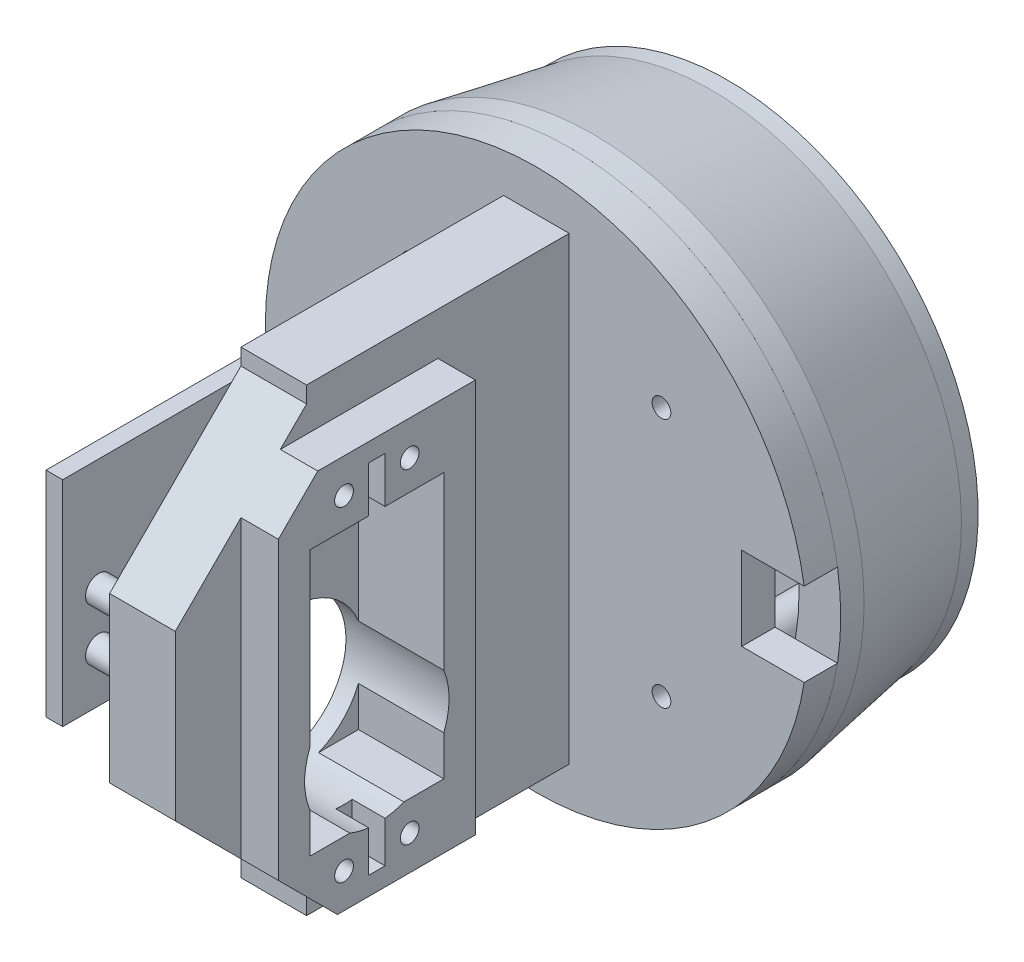
from build123d import *

# Parameters (mm, degrees)
SKETCH2_R                      = 41.27500000000001
SKETCH2_R_2                    = 34.925000000000004
BOSS_EXTRUDE1_DEPTH            = 3.555999999999654
SKETCH54_R                     = 41.27500000000001
SKETCH54_R_2                   = 34.92500000000001
BOSS_EXTRUDE2_DEPTH            = 25.4
BOSS_EXTRUDE2_TAPER            = 10.000000000000021
BOSS_EXTRUDE3_START            = -18.006319777
BOSS_EXTRUDE3_OUTLINE_R        = 38.1
BOSS_EXTRUDE3_DEPTH            = 3.81
BOSS_EXTRUDE5_REACH            = 72.778
SKETCH63_R                     = 3.175000000000002
SKETCH63_R_2                   = 3.175000000000009
SKETCH63_R_3                   = 3.1750000000000056
F_3_0MM_DOWEL_HOLE4_D          = 2.85
F_3_0MM_DOWEL_HOLE4_DEPTH      = 6.858
F_3_0MM_DOWEL_HOLE3_D          = 2.999994
CUT_EXTRUDE2_REACH             = 126.878
SKETCH58_W                     = 12.700000000000001
SKETCH58_H                     = 21.266668123278706
SKETCH60_R                     = 1.4249999999999978
SKETCH60_R_2                   = 1.4250000000000005
CUT_EXTRUDE4_DEPTH             = 70.71188168256496
SKETCH64_R                     = 1.425000000000001
SKETCH64_R_2                   = 1.4249999999999978
SKETCH64_R_3                   = 1.499996999999999
BOSS_EXTRUDE6_DEPTH            = 2.54
SKETCH67_R                     = 41.27500000000003
SKETCH67_R_2                   = 1.4249999999999985
SKETCH67_R_3                   = 1.4249999999999976
BOSS_EXTRUDE7_DEPTH            = 5.08
SKETCH68_W                     = 20
SKETCH68_H                     = 12.7
CUT_EXTRUDE5_DEPTH             = 5.08
BOSS_EXTRUDE8_START            = 11.43
SKETCH70_W                     = 70.00000000000001
SKETCH70_H                     = 70
BOSS_EXTRUDE8_DEPTH            = 5
BOSS_EXTRUDE9_DEPTH            = 5.699999999999999
CUT_EXTRUDE6_DEPTH             = 13
F_3_0MM_DOWEL_HOLE5_AT_2_COUNT = 2
F_3_0MM_DOWEL_HOLE5_AT_2_PITCH = 10
F_3_0MM_DOWEL_HOLE5_AT_3_COUNT = 2
F_3_0MM_DOWEL_HOLE5_AT_3_PITCH = 49.5
F_3_0MM_DOWEL_HOLE5_AT_4_COUNT = 2
F_3_0MM_DOWEL_HOLE5_AT_4_PITCH = 50.5
CUT_EXTRUDE7_DEPTH             = 100.24306365899265
CUT_EXTRUDE7_DEPTH_BACK        = 100.24306365899265
SKETCH76_R                     = 11
CUT_EXTRUDE9_DEPTH             = 5
SKETCH78_R                     = 2.5000000000000018
BOSS_EXTRUDE10_DEPTH           = 10
SKETCH79_R                     = 2.000000000000003
BOSS_EXTRUDE11_DEPTH           = 10
CUT_EXTRUDE10_DEPTH            = 101.45785526758407
CHAMFER1_SIZE                  = 1.27
SKETCH81_R                     = 2.510000000000005
SKETCH81_R_2                   = 2.0100035999999983
SKETCH81_R_3                   = 2.0100000000000047
BOSS_EXTRUDE12_DEPTH           = 2.54


with BuildPart() as part:
    # Sketch2 → Boss-Extrude1 (new body)
    with BuildSketch(Plane(origin=(0, 0.7215916123591171, 0), x_dir=(1, 0, 0), z_dir=(0, 0, 1))):
        with Locations((11.43, -1.4797279014976155)):
            Circle(SKETCH2_R)
        with Locations((11.43, -1.4797279014976155)):
            Circle(SKETCH2_R_2, mode=Mode.SUBTRACT)
    extrude(amount=BOSS_EXTRUDE1_DEPTH)

    # Sketch54 → Boss-Extrude2 (add)
    with BuildSketch(Plane(origin=(0, 0, 0), x_dir=(-1, 0, 0), z_dir=(0, 0, -1))):
        with Locations((-11.43, -0.7581362891384984)):
            Circle(SKETCH54_R)
        with Locations(Location((-11.43, -0.7581362891384984, 0), (0, 0, 180))):
            Circle(SKETCH54_R_2, mode=Mode.SUBTRACT)
    extrude(amount=BOSS_EXTRUDE2_DEPTH, taper=BOSS_EXTRUDE2_TAPER)

    # Boss-Extrude3: read off the stored shape, not the designer's step
    # Boss-Extrude3 outline → Boss-Extrude3 (add)
    with BuildSketch(Plane.XY.offset(BOSS_EXTRUDE3_START)):
        with Locations((11.43, -0.758136289)):
            Circle(BOSS_EXTRUDE3_OUTLINE_R)
    extrude(amount=BOSS_EXTRUDE3_DEPTH)

    # Sketch63 → Boss-Extrude5 (add, up to next)
    with BuildSketch(Plane.XY.offset(3.555999999999654), mode=Mode.PRIVATE) as boss_extrude5_sk1:
        with Locations((-7.620000000000005, 18.291863710861502)):
            Circle(SKETCH63_R)
    boss_extrude5_tool1 = extrude(boss_extrude5_sk1.sketch, amount=-BOSS_EXTRUDE5_REACH, mode=Mode.PRIVATE) - part.part
    # Sketch63 → Boss-Extrude5 (add, up to next)
    with BuildSketch(Plane.XY.offset(3.555999999999654), mode=Mode.PRIVATE) as boss_extrude5_sk2:
        with Locations((30.479999999999997, 18.29186371086151)):
            Circle(SKETCH63_R_2)
    boss_extrude5_tool2 = extrude(boss_extrude5_sk2.sketch, amount=-BOSS_EXTRUDE5_REACH, mode=Mode.PRIVATE) - part.part
    # Sketch63 → Boss-Extrude5 (add, up to next)
    with BuildSketch(Plane.XY.offset(3.555999999999654), mode=Mode.PRIVATE) as boss_extrude5_sk3:
        with Locations((30.480000000000004, -19.8081362891385)):
            Circle(SKETCH63_R_2)
    boss_extrude5_tool3 = extrude(boss_extrude5_sk3.sketch, amount=-BOSS_EXTRUDE5_REACH, mode=Mode.PRIVATE) - part.part
    # Sketch63 → Boss-Extrude5 (add, up to next)
    with BuildSketch(Plane.XY.offset(3.555999999999654), mode=Mode.PRIVATE) as boss_extrude5_sk4:
        with Locations((-7.620000000000005, -19.8081362891385)):
            Circle(SKETCH63_R_3)
    boss_extrude5_tool4 = extrude(boss_extrude5_sk4.sketch, amount=-BOSS_EXTRUDE5_REACH, mode=Mode.PRIVATE) - part.part
    add(boss_extrude5_tool1.solids().sort_by_distance((-7.62, 18.291864, 3.556))[0])
    add(boss_extrude5_tool2.solids().sort_by_distance((30.48, 18.291864, 3.556))[0])
    add(boss_extrude5_tool3.solids().sort_by_distance((30.48, -19.808136, 3.556))[0])
    add(boss_extrude5_tool4.solids().sort_by_distance((-7.62, -19.808136, 3.556))[0])

    # Ø3.0mm Dowel Hole4
    with Locations(Plane.XY.offset(3.555999999999654)):
        with Locations((-7.62, 18.291863711), (30.48, 18.291863711), (30.48, -19.808136289), (-7.62, -19.808136289)):
            Hole(F_3_0MM_DOWEL_HOLE4_D / 2, depth=F_3_0MM_DOWEL_HOLE4_DEPTH)

    # Ø3.0mm Dowel Hole3 (through all)
    with Locations(Plane(origin=(0, 0, -18.006319777286222), x_dir=(-1, 0, 0), z_dir=(0, 0, -1))):
        with Locations((-11.43, -0.758136289)):
            Hole(F_3_0MM_DOWEL_HOLE3_D / 2)

    # Cut-Extrude2: up to this cone (the profile starts outside it)
    cut_extrude2_end = Plane(origin=(11.43, -0.7581362891384984, -11.65632), z_dir=(0, 0, -1)) * Cone(7.999516737370435, 65.961130686173, 328.7166474235434, mode=Mode.PRIVATE)
    # Sketch58 → Cut-Extrude2 (cut, up to the surface)
    with BuildSketch(Plane(origin=(-63.5, 0, 0), x_dir=(0, 0, -1), z_dir=(1, 0, 0)), mode=Mode.PRIVATE) as cut_extrude2_sk1:
        with Locations((11.656319777286228, -0.08753137128510957)):
            Rectangle(SKETCH58_W, SKETCH58_H)
    cut_extrude2_tool1 = extrude(cut_extrude2_sk1.sketch, amount=CUT_EXTRUDE2_REACH, mode=Mode.PRIVATE) - cut_extrude2_end
    add(cut_extrude2_tool1.solids().sort_by_distance((-63.5, -0.087531, -11.65632))[0], mode=Mode.SUBTRACT)

    # Sketch60 → Cut-Extrude4 (cut, through all)
    with BuildSketch(Plane.XY.offset(-14.196319777286222)):
        with Locations((18.43, -0.7581362891384957)):
            Circle(SKETCH60_R)
        with Locations((4.429999999999999, -0.7581362891384984)):
            Circle(SKETCH60_R_2)
    extrude(amount=-CUT_EXTRUDE4_DEPTH, mode=Mode.SUBTRACT)

    # Sketch64 → Boss-Extrude6 (add)
    with BuildSketch(Plane(origin=(0, 0, -18.006319777286222), x_dir=(-1, 0, 0), z_dir=(0, 0, -1))):
        with BuildLine():
            ThreePointArc((25.344366452837203, -10.720865432924475), (26.663599038852283, -0.05977229582778121), (24.954487952256596, 10.545802690354252))
            ThreePointArc((24.954487952256596, 10.545802690354252), (-49.52359903885228, -1.4565002824492193), (25.344366452837203, -10.720865432924475))
        make_face()
        with Locations(Location((-4.429999999999999, -0.7581362891384984, 0), (0, 0, 180))):
            Circle(SKETCH64_R, mode=Mode.SUBTRACT)
        with Locations(Location((-18.43, -0.7581362891384957, 0), (0, 0, 180))):
            Circle(SKETCH64_R_2, mode=Mode.SUBTRACT)
        with Locations((-11.43, -0.7581362891384984)):
            Circle(SKETCH64_R_3, mode=Mode.SUBTRACT)
    extrude(amount=BOSS_EXTRUDE6_DEPTH)


with BuildPart() as body_2:
    # Sketch67 → Boss-Extrude7 (new body)
    with BuildSketch(Plane.XY.offset(3.555999999999654)):
        with Locations((11.43, -0.7581362891384984)):
            Circle(SKETCH67_R)
        with Locations((-7.620000000000005, -19.8081362891385)):
            Circle(SKETCH67_R_2, mode=Mode.SUBTRACT)
        with Locations((30.480000000000004, -19.8081362891385)):
            Circle(SKETCH67_R_3, mode=Mode.SUBTRACT)
        with Locations((30.479999999999997, 18.29186371086151)):
            Circle(SKETCH67_R_3, mode=Mode.SUBTRACT)
        with Locations((-7.620000000000005, 18.291863710861502)):
            Circle(SKETCH67_R_2, mode=Mode.SUBTRACT)
    extrude(amount=BOSS_EXTRUDE7_DEPTH)

    # Sketch68 → Cut-Extrude5 (cut)
    with BuildSketch(Plane.XY.offset(8.635999999999655)):
        with Locations((52.70500000000003, -0.7581362891385006)):
            Rectangle(SKETCH68_W, SKETCH68_H)
    extrude(amount=-CUT_EXTRUDE5_DEPTH, mode=Mode.SUBTRACT)

    # Sketch70 → Boss-Extrude8 (add, symmetric)
    with BuildSketch(Plane(origin=(0, 0, 0), x_dir=(0, 0, -1), z_dir=(1, 0, 0)).offset(BOSS_EXTRUDE8_START)):
        with Locations((-43.63599999999966, -0.7581362891384948)):
            Rectangle(SKETCH70_W, SKETCH70_H)
    extrude(amount=BOSS_EXTRUDE8_DEPTH, both=True)

    # Sketch71 → Boss-Extrude9 (add)
    with BuildSketch(Plane(origin=(16.43, 0, 0), x_dir=(0, 0, -1), z_dir=(1, 0, 0))):
        Polygon((-58.635999999999655, 27.741863710861526), (-28.635999999999655, 27.741863710861526), (-28.635999999999648, -32.25813628913847), (-58.63599999999963, -32.25813628913847), align=None)
    extrude(amount=BOSS_EXTRUDE9_DEPTH)

    # Sketch72 → Cut-Extrude6 (cut)
    with BuildSketch(Plane(origin=(22.13, 0, 0), x_dir=(0, 0, -1), z_dir=(1, 0, 0))):
        Polygon((-53.83599999999965, 17.94186371086152), (-33.435999999999645, 17.941863710861533), (-33.435999999999645, -22.458136289138466), (-53.83599999999965, -22.45813628913848), align=None)
    extrude(amount=-CUT_EXTRUDE6_DEPTH, mode=Mode.SUBTRACT)

    # Sketch75 → Ø3.0mm Dowel Hole5 (revolve, cut)
    with BuildSketch(Plane(origin=(22.13, -27.00813628913847, 38.63599999999965), x_dir=(0, 0, -1), z_dir=(0, 1, 0))):
        Polygon((0, 0), (-3.85e-15, 15.700000000000003), (1.4249999999999974, 15.700000000000003), (1.4249999999999994, -1e-17), align=None)
    f_3_0mm_dowel_hole5 = revolve(axis=Axis((28.47999999999999, -27.00813628913847, 38.63599999999965), (-1, 0, 0)), mode=Mode.SUBTRACT)

    # Ø3.0mm Dowel Hole5 at 2: Ø3.0mm Dowel Hole5 ×2
    with Locations(*[(0, 0, i * F_3_0MM_DOWEL_HOLE5_AT_2_PITCH) for i in range(1, F_3_0MM_DOWEL_HOLE5_AT_2_COUNT)]):
        add(f_3_0mm_dowel_hole5, mode=Mode.SUBTRACT)

    # Ø3.0mm Dowel Hole5 at 3: Ø3.0mm Dowel Hole5 ×2
    with Locations(*[(0, i * F_3_0MM_DOWEL_HOLE5_AT_3_PITCH, 0) for i in range(1, F_3_0MM_DOWEL_HOLE5_AT_3_COUNT)]):
        add(f_3_0mm_dowel_hole5, mode=Mode.SUBTRACT)

    # Ø3.0mm Dowel Hole5 at 4: Ø3.0mm Dowel Hole5 ×2
    with Locations(*[Vector(0, 0.9801980198019803, 0.19801980198019806) * (i * F_3_0MM_DOWEL_HOLE5_AT_4_PITCH) for i in range(1, F_3_0MM_DOWEL_HOLE5_AT_4_COUNT)]):
        add(f_3_0mm_dowel_hole5, mode=Mode.SUBTRACT)

    # Sketch76 → Cut-Extrude7 (cut, two sides: drawn at the far end of the back side and taken through both)
    with BuildSketch(Plane(origin=(9.13, 0, 0), x_dir=(0, 0, -1), z_dir=(1, 0, 0)).offset(-CUT_EXTRUDE7_DEPTH_BACK)):
        with Locations(Location((-43.63599999999964, -12.258136289138482, 0), (0, 0, 338.013597003))):
            Circle(SKETCH76_R)
    extrude(amount=CUT_EXTRUDE7_DEPTH + CUT_EXTRUDE7_DEPTH_BACK, mode=Mode.SUBTRACT)

    # Sketch77 → Cut-Extrude9 (cut)
    with BuildSketch(Plane(origin=(22.13, 0, 0), x_dir=(0, 0, -1), z_dir=(1, 0, 0))):
        Polygon((-44.88599999999964, 24.941863710861522), (-42.38599999999964, 24.94186371086152), (-42.38599999999965, 17.941863710861515), (-44.88599999999963, 17.941863710861515), align=None)
        Polygon((-44.88599999999964, -29.458136289138476), (-42.38599999999965, -29.458136289138476), (-42.38599999999964, -22.45813628913848), (-44.88599999999964, -22.45813628913848), align=None)
    extrude(amount=-CUT_EXTRUDE9_DEPTH, mode=Mode.SUBTRACT)

    # Sketch78 → Boss-Extrude10 (add)
    with BuildSketch(Plane.ZY.offset(-6.429999999999999)):
        with Locations((43.63599999999964, 10.741863710861484)):
            Circle(SKETCH78_R)
    extrude(amount=BOSS_EXTRUDE10_DEPTH)

    # Sketch79 → Boss-Extrude11 (add)
    with BuildSketch(Plane.ZY.offset(-6.429999999999999)):
        with Locations((60.30111511679786, 3.2102714393784137)):
            Circle(SKETCH79_R)
        with Locations(Location((60.30111511679786, -4.726544017655412, 0), (0, 0, 180))):
            Circle(SKETCH79_R)
    extrude(amount=BOSS_EXTRUDE11_DEPTH)

    # Sketch80 → Cut-Extrude10 (cut, through all)
    with BuildSketch(Plane.ZY.offset(-6.429999999999999)):
        Polygon((78.63599999999967, 34.24186371086151), (48.63599999999967, 34.24186371086151), (48.63599999999967, 31.741863710861587), (68.63599999999967, 11.741863710861503), (68.63599999999967, -13.258136289138498), (48.63599999999967, -33.258136289138584), (48.63599999999967, -35.7581362891385), (78.63599999999967, -35.7581362891385), align=None)
    extrude(amount=-CUT_EXTRUDE10_DEPTH, mode=Mode.SUBTRACT)

    # Chamfer1
    chamfer1_edges = [body_2.edges().sort_by_distance(p)[0] for p in [
        (6.429999999999999, 10.741863710861484, 41.13599999999964),
        (6.429999999999999, 3.210271439378414, 58.30111511679786),
        (6.429999999999999, -4.726544017655413, 62.30111511679786),
    ]]
    chamfer(chamfer1_edges, length=CHAMFER1_SIZE)


with BuildPart() as body_3:
    # Sketch81 → Boss-Extrude12 (new body)
    with BuildSketch(Plane.ZY.offset(3.570000000000001)):
        with BuildLine():
            Line((34.03599999999965, 20.32), (65.78599999999965, 20.32))
            Line((65.78599999999965, 20.32), (65.78599999999965, -12.258136289138479))
            Line((65.78599999999965, -12.258136289138479), (55.62599999999965, -12.258136289138479))
            ThreePointArc((55.62599999999965, -12.258136289138479), (52.32254219659335, -3.8667971326053205), (44.17543926155394, 0))
            Line((44.17543926155394, 0), (34.03599999999965, -1.21e-15))
            Line((34.03599999999965, -1.21e-15), (34.03599999999965, 20.32))
        make_face()
        with Locations((43.63599999999964, 10.741863710861484)):
            Circle(SKETCH81_R, mode=Mode.SUBTRACT)
        with Locations((60.30111511679786, 3.2102714393784137)):
            Circle(SKETCH81_R_2, mode=Mode.SUBTRACT)
        with Locations((60.30111511679786, -4.726544017655412)):
            Circle(SKETCH81_R_3, mode=Mode.SUBTRACT)
    extrude(amount=BOSS_EXTRUDE12_DEPTH)


solid = Compound([part.part, body_2.part, body_3.part])
